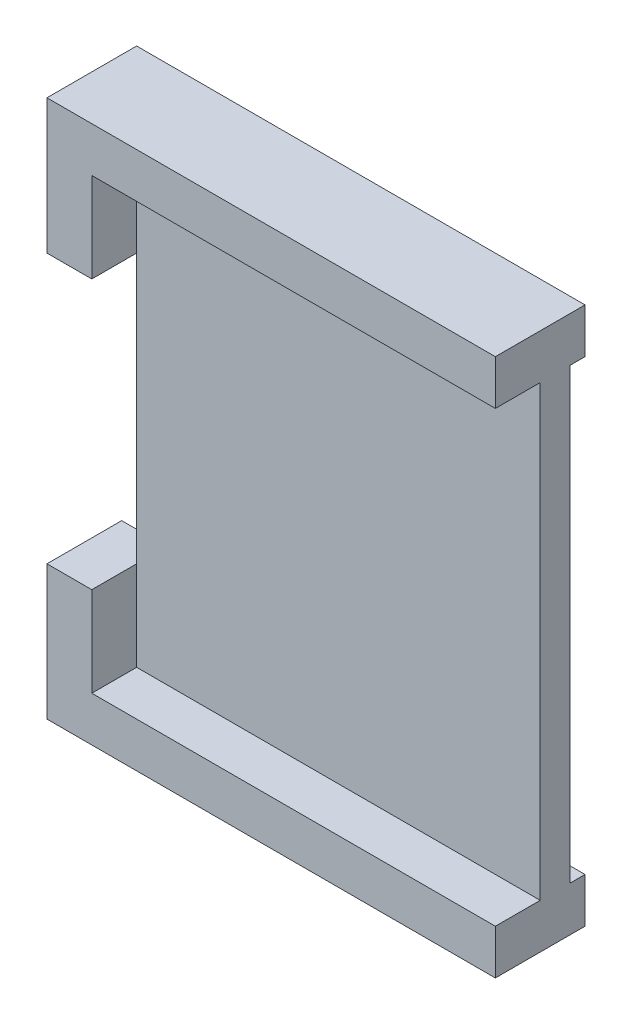
from build123d import *

# Parameters (mm, degrees)
BOSS_EXTRUDE1_DEPTH = 2
BOSS_EXTRUDE2_DEPTH = 5
SKETCH1_4_W         = 30
SKETCH1_4_H         = 3
BOSS_EXTRUDE3_DEPTH = 1


with BuildPart() as part:
    # Sketch1 → Boss-Extrude1 (new body)
    with BuildSketch(Plane.XY):
        Polygon((15, 18), (-15, 18), (-15, 9), (-12, 9), (-12, -9), (-15, -9), (-15, -18), (15, -18), align=None)
    extrude(amount=BOSS_EXTRUDE1_DEPTH)

    # Sketch1<3> → Boss-Extrude2 (add)
    with BuildSketch(Plane.XY):
        Polygon((-15, 9), (-12, 9), (-12, 15), (15, 15), (15, 18), (-15, 18), align=None)
        Polygon((-12, -15), (-12, -9), (-15, -9), (-15, -18), (15, -18), (15, -15), align=None)
    extrude(amount=BOSS_EXTRUDE2_DEPTH)

    # Sketch1<4> → Boss-Extrude3 (add)
    with BuildSketch(Plane.XY):
        with Locations((0, 16.5)):
            Rectangle(SKETCH1_4_W, SKETCH1_4_H)
        with Locations((0, -16.5)):
            Rectangle(SKETCH1_4_W, SKETCH1_4_H)
    extrude(amount=-BOSS_EXTRUDE3_DEPTH)


solid = part.part
